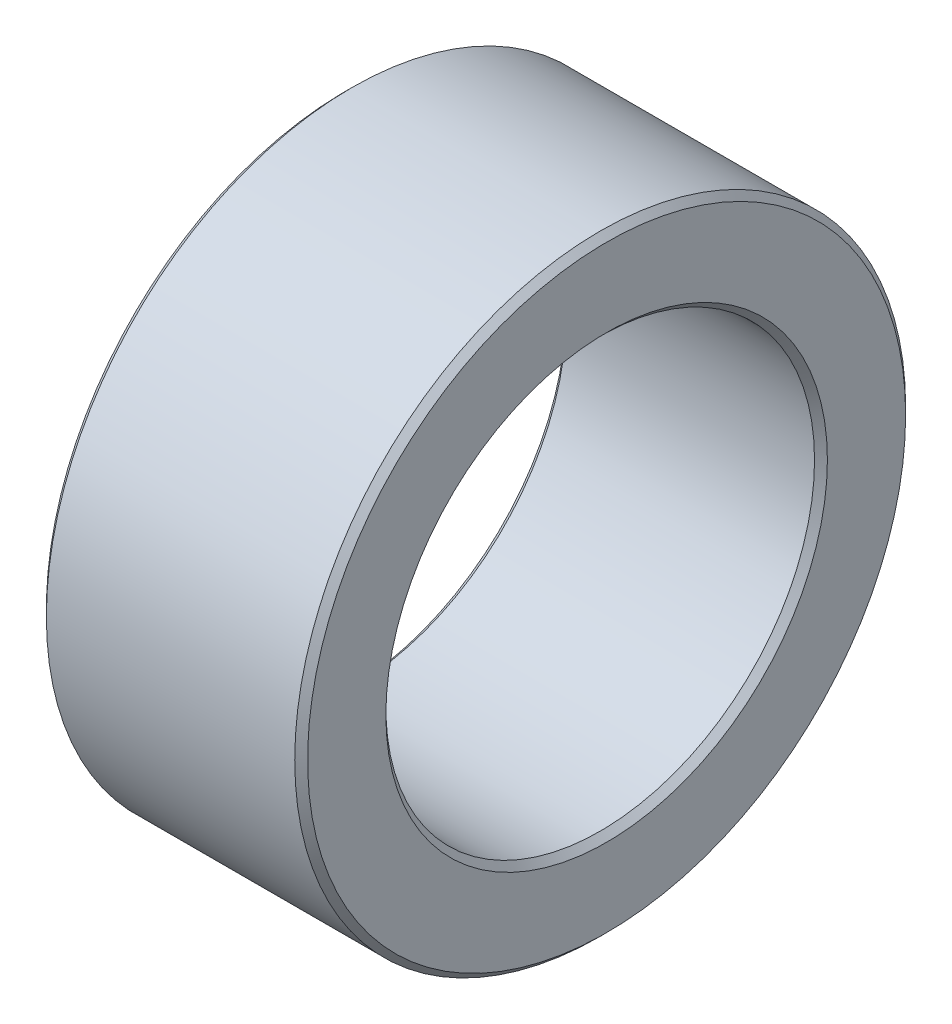
from build123d import *

# Parameters (mm, degrees)
SKETCH1_R           = 36.195
SKETCH1_R_2         = 25.4
BOSS_EXTRUDE1_DEPTH = 30.95625
CHAMFER1_SIZE       = 0.762


with BuildPart() as part:
    # Sketch1 → Boss-Extrude1 (new body)
    with BuildSketch(Plane(origin=(0, 0, 0), x_dir=(0, 0, -1), z_dir=(1, 0, 0))):
        Circle(SKETCH1_R)
        Circle(SKETCH1_R_2, mode=Mode.SUBTRACT)
    extrude(amount=BOSS_EXTRUDE1_DEPTH)

    # Chamfer1
    chamfer1_edges = [part.edges().sort_by_distance(p)[0] for p in [
        (0, 0, 25.4),
        (30.95625, 0, 25.4),
        (30.95625, 0, 36.195),
        (0, 0, 36.195),
    ]]
    chamfer(chamfer1_edges, length=CHAMFER1_SIZE)


solid = part.part
